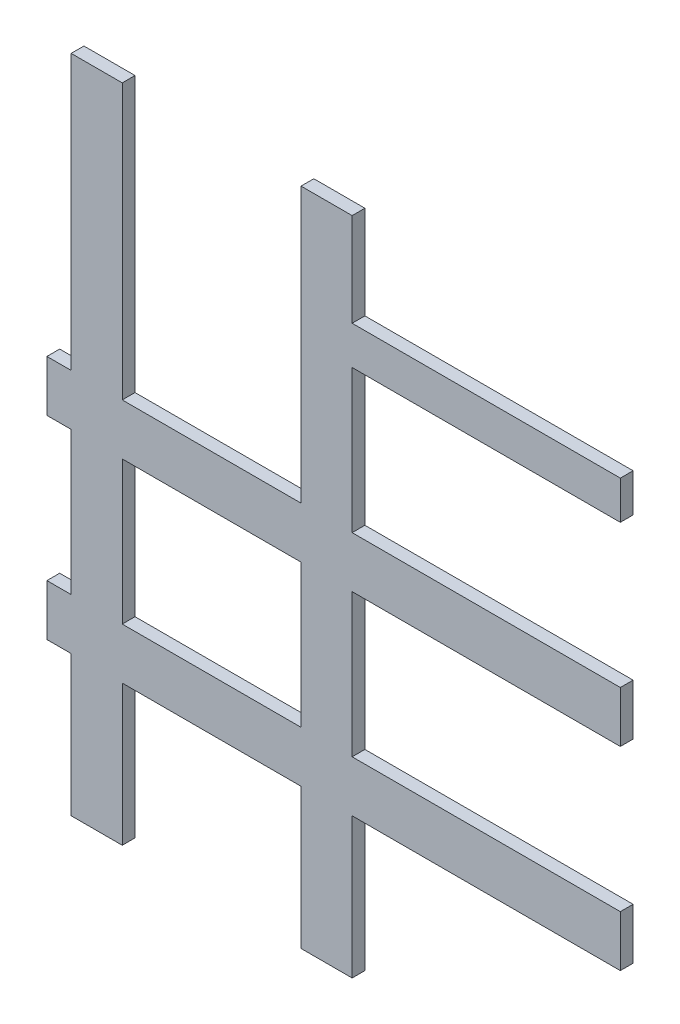
from build123d import *

# Parameters (mm, degrees)
SCHIZZO1_W                        = 4
SCHIZZO1_H                        = 51.7
ESTRUSIONE_ESTRUSIONE1_DEPTH      = 1
ESTRUSIONE_ESTRUSIONE2_DEPTH      = 18
ESTRUSIONE_ESTRUSIONE2_DEPTH_BACK = 5.9
SCHIZZO2_W                        = 1
SCHIZZO2_H                        = 4
ESTRUSIONE_ESTRUSIONE3_DEPTH      = 18
ESTRUSIONE_ESTRUSIONE3_DEPTH_BACK = 5.9
SCHIZZO3_W                        = 1
SCHIZZO3_H                        = 4
ESTRUSIONE_ESTRUSIONE4_DEPTH      = 21.5
ESTRUSIONE_ESTRUSIONE4_DEPTH_BACK = 30.2
SCHIZZO4_W                        = 4
SCHIZZO4_H                        = 1
SCHIZZO5_W                        = 1
SCHIZZO5_H                        = 3
ESTRUSIONE_ESTRUSIONE5_DEPTH      = 21
SCHIZZO7_W                        = 1
SCHIZZO7_H                        = 4
ESTRUSIONE_ESTRUSIONE6_DEPTH      = 21
SCHIZZO8_W                        = 1
SCHIZZO8_H                        = 4
ESTRUSIONE_ESTRUSIONE7_DEPTH      = 21


with BuildPart() as part:
    # Schizzo1 → Estrusione-Estrusione1 (new body)
    with BuildSketch(Plane.XY):
        with Locations((2, 25.85)):
            Rectangle(SCHIZZO1_W, SCHIZZO1_H)
    extrude(amount=ESTRUSIONE_ESTRUSIONE1_DEPTH)

    # Schizzo2 → Estrusione-Estrusione2 (add, two sides: drawn at the far end of the back side and taken through both)
    with BuildSketch(Plane(origin=(4, 0, 0), x_dir=(0, 0, -1), z_dir=(1, 0, 0)).offset(-ESTRUSIONE_ESTRUSIONE2_DEPTH_BACK)):
        with Locations((-0.5, 28.2)):
            Rectangle(SCHIZZO2_W, SCHIZZO2_H)
    extrude(amount=ESTRUSIONE_ESTRUSIONE2_DEPTH + ESTRUSIONE_ESTRUSIONE2_DEPTH_BACK)

    # Schizzo3 → Estrusione-Estrusione3 (add, two sides: drawn at the far end of the back side and taken through both)
    with BuildSketch(Plane(origin=(4, 0, 0), x_dir=(0, 0, -1), z_dir=(1, 0, 0)).offset(-ESTRUSIONE_ESTRUSIONE3_DEPTH_BACK)):
        with Locations((-0.5, 13)):
            Rectangle(SCHIZZO3_W, SCHIZZO3_H)
    extrude(amount=ESTRUSIONE_ESTRUSIONE3_DEPTH + ESTRUSIONE_ESTRUSIONE3_DEPTH_BACK)

    # Schizzo4 → Estrusione-Estrusione4 (add, two sides: drawn at the far end of the back side and taken through both)
    with BuildSketch(Plane(origin=(0, 30.2, 0), x_dir=(1, 0, 0), z_dir=(0, 1, 0)).offset(-ESTRUSIONE_ESTRUSIONE4_DEPTH_BACK)):
        with Locations((20, -0.5)):
            Rectangle(SCHIZZO4_W, SCHIZZO4_H)
    extrude(amount=ESTRUSIONE_ESTRUSIONE4_DEPTH + ESTRUSIONE_ESTRUSIONE4_DEPTH_BACK)

    # Schizzo5 → Estrusione-Estrusione5 (add)
    with BuildSketch(Plane(origin=(22, 0, 0), x_dir=(0, 0, -1), z_dir=(1, 0, 0))):
        with Locations((-0.5, 42.898738045)):
            Rectangle(SCHIZZO5_W, SCHIZZO5_H)
    extrude(amount=ESTRUSIONE_ESTRUSIONE5_DEPTH)

    # Schizzo7 → Estrusione-Estrusione6 (add)
    with BuildSketch(Plane(origin=(22, 0, 0), x_dir=(0, 0, -1), z_dir=(1, 0, 0))):
        with Locations((-0.5, 13)):
            Rectangle(SCHIZZO7_W, SCHIZZO7_H)
    extrude(amount=ESTRUSIONE_ESTRUSIONE6_DEPTH)

    # Schizzo8 → Estrusione-Estrusione7 (add)
    with BuildSketch(Plane(origin=(22, 0, 0), x_dir=(0, 0, -1), z_dir=(1, 0, 0))):
        with Locations((-0.5, 28.2)):
            Rectangle(SCHIZZO8_W, SCHIZZO8_H)
    extrude(amount=ESTRUSIONE_ESTRUSIONE7_DEPTH)


solid = part.part
